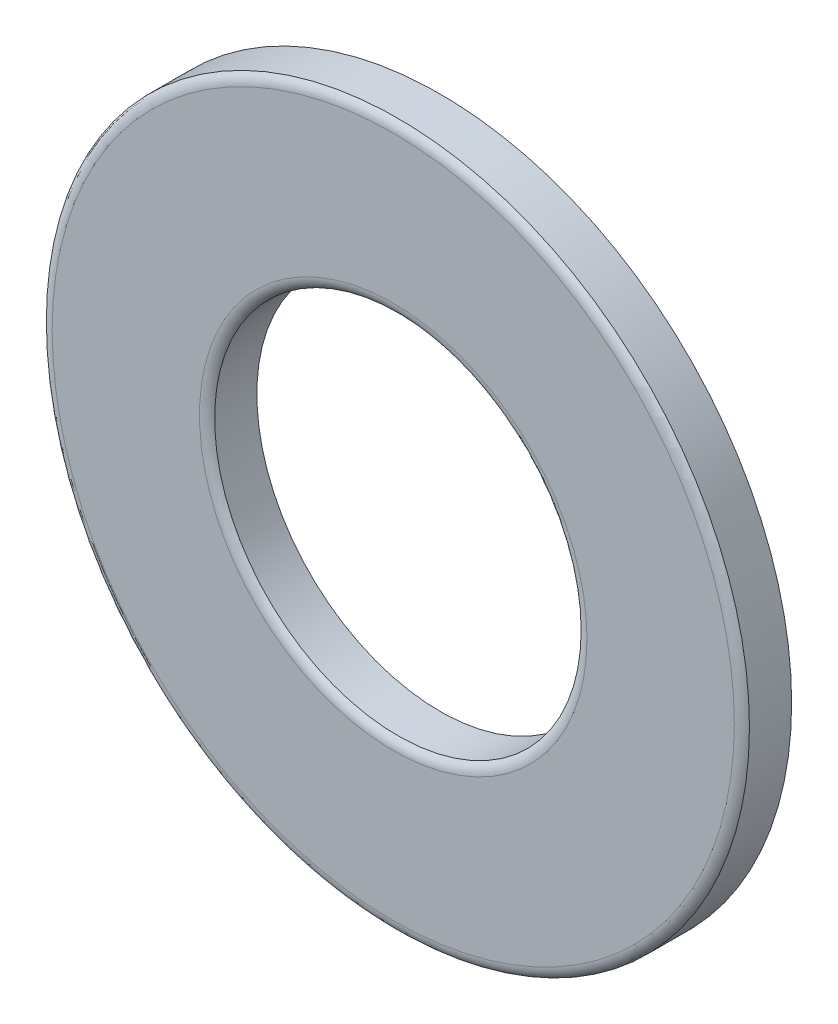
from build123d import *
from OCP.BRepFilletAPI import BRepFilletAPI_MakeChamfer

# Parameters (mm, degrees)
BOSS_EXTRUDE1_START = -0.635
SKETCH3_R           = 9.525
SKETCH3_R_2         = 4.9657
BOSS_EXTRUDE1_DEPTH = 1.27
CHAMFER1_SIZE       = 0.127
CHAMFER1_SIZE2      = 0.073323484
FILLET1_R           = 0.381


with BuildPart() as part:
    # Sketch3 → Boss-Extrude1 (new body)
    with BuildSketch(Plane.XY.offset(BOSS_EXTRUDE1_START)):
        Circle(SKETCH3_R)
        Circle(SKETCH3_R_2, mode=Mode.SUBTRACT)
    extrude(amount=BOSS_EXTRUDE1_DEPTH)

    # Chamfer1: one chamfer whose edges measure the first distance from different faces: ONE call of the kernel's chamfer builder (chamfer() names one face for all edges)
    chamfer1_edges_1 = [part.edges().sort_by_distance(p)[0] for p in [
        (-9.525, 0, 0.635),
    ]]
    chamfer1_side_1 = [part.faces().sort_by_distance(p)[0] for p in [
        (-9.525, 0, 0),
    ]]
    chamfer1_edges_2 = [part.edges().sort_by_distance(p)[0] for p in [
        (-4.9657, 0, 0.635),
    ]]
    chamfer1_side_2 = [part.faces().sort_by_distance(p)[0] for p in [
        (-4.9657, 0, 0),
    ]]
    chamfer1 = BRepFilletAPI_MakeChamfer(part.part.solid().wrapped)
    for e in chamfer1_edges_1:
        chamfer1.Add(CHAMFER1_SIZE, CHAMFER1_SIZE2, e.wrapped, chamfer1_side_1[0].wrapped)  # the first distance lies on this face
    for e in chamfer1_edges_2:
        chamfer1.Add(CHAMFER1_SIZE, CHAMFER1_SIZE2, e.wrapped, chamfer1_side_2[0].wrapped)  # the first distance lies on this face
    add(Compound.cast(chamfer1.Shape()), mode=Mode.REPLACE)

    # Fillet1
    # the kernel refuses this fillet: 0.381 mm, written as the material it takes off along each edge
    with BuildSketch(Plane(origin=(0, 0, 0.635), x_dir=(1, 0, 0), z_dir=(0, -1, 0))) as fillet1_piece_1:
        with BuildLine():
            CenterArc((9.241019367, -0.381), FILLET1_R, 41.810314896, 48.189685104)
            Line((9.241019367, 0), (9.241019367, 0.00762))
            Line((9.241019367, 0.00762), (9.451676516, 0.00762))
            Line((9.451676516, 0.00762), (9.458275629, 0.00381))
            ThreePointArc((9.458275629, 0.00381), (9.494937371, -0.05969), (9.530679613, -0.12192))
            Line((9.530679613, -0.12192), (9.525, -0.127))
        make_face()
    revolve(axis=Axis((0, 0, 0.635), (0, 0, 1)), mode=Mode.SUBTRACT)
    with BuildSketch(Plane(origin=(0, 0, 0.635), x_dir=(1, 0, 0), z_dir=(0, -1, 0))) as fillet1_piece_2:
        with BuildLine():
            CenterArc((5.249680633, -0.381), FILLET1_R, 90, 48.189685104)
            Line((4.9657, -0.127), (4.960020387, -0.12192))
            ThreePointArc((4.960020387, -0.12192), (4.995762629, -0.05969), (5.032424371, 0.00381))
            Line((5.032424371, 0.00381), (5.039023484, 0.00762))
            Line((5.039023484, 0.00762), (5.249680633, 0.00762))
            Line((5.249680633, 0.00762), (5.249680633, 0))
        make_face()
    revolve(axis=Axis((0, 0, 0.635), (0, 0, 1)), mode=Mode.SUBTRACT)


solid = part.part
